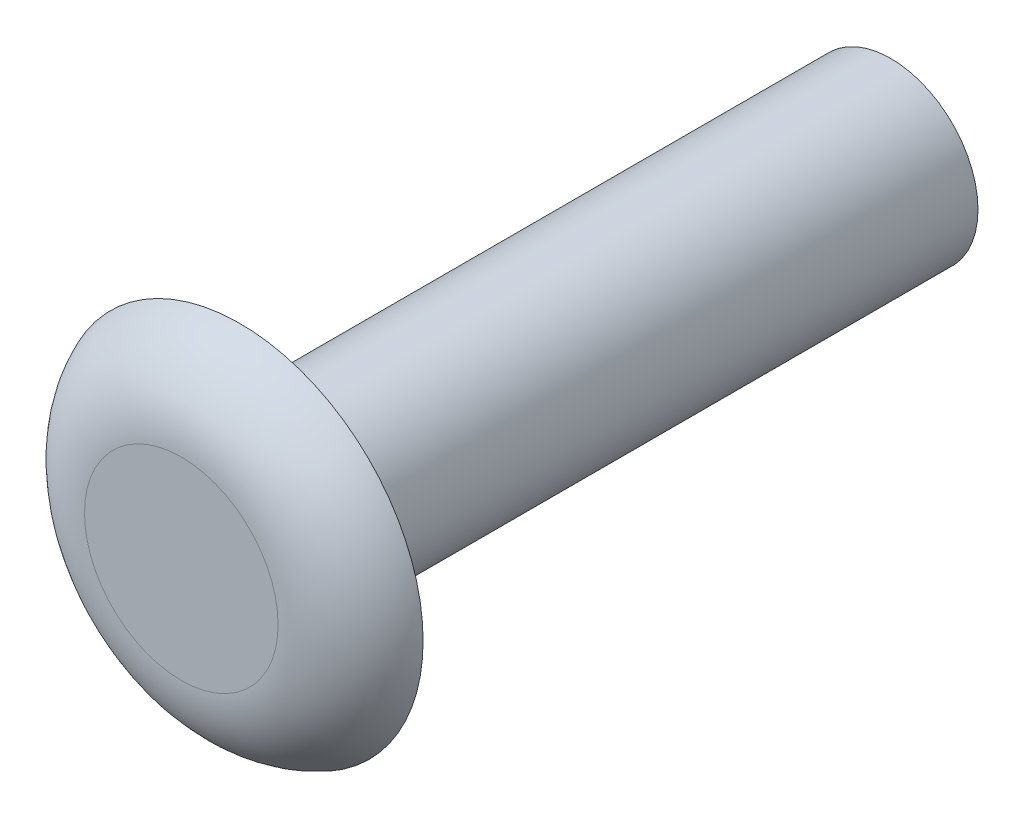
from build123d import *

# Parameters (mm, degrees)
SKETCH1_R           = 5.0038
BOSS_EXTRUDE1_DEPTH = 1.6002
SKETCH2_R           = 2.38125
BOSS_EXTRUDE2_DEPTH = 17.78
FILLET1_R           = 2.54


with BuildPart() as part:
    # Sketch1 → Boss-Extrude1 (new body)
    with BuildSketch(Plane.XY):
        Circle(SKETCH1_R)
    extrude(amount=BOSS_EXTRUDE1_DEPTH)

    # Sketch2 → Boss-Extrude2 (add)
    with BuildSketch(Plane.XY):
        Circle(SKETCH2_R)
    extrude(amount=-BOSS_EXTRUDE2_DEPTH)

    # Fillet1
    # the kernel refuses this fillet: 2.54 mm, written as the material it takes off along each edge
    with BuildSketch(Plane(origin=(0, 0, 1.6002), x_dir=(1, 0, 0), z_dir=(0, -1, 0))) as fillet1_piece_1:
        with BuildLine():
            CenterArc((2.644059345, -2.54), FILLET1_R, 21.715617283, 68.284382717)
            Line((2.644059345, 0), (2.644059345, 0.0508))
            Line((2.644059345, 0.0508), (5.0038, 0.0508))
            Line((5.0038, 0.0508), (5.0546, 0))
            ThreePointArc((5.0546, 0), (5.0546, -0.8001), (5.050994813, -1.581404))
            Line((5.050994813, -1.581404), (5.0038, -1.6002))
        make_face()
    revolve(axis=Axis((0, 0, 1.6002), (0, 0, 1)), mode=Mode.SUBTRACT)


solid = part.part
